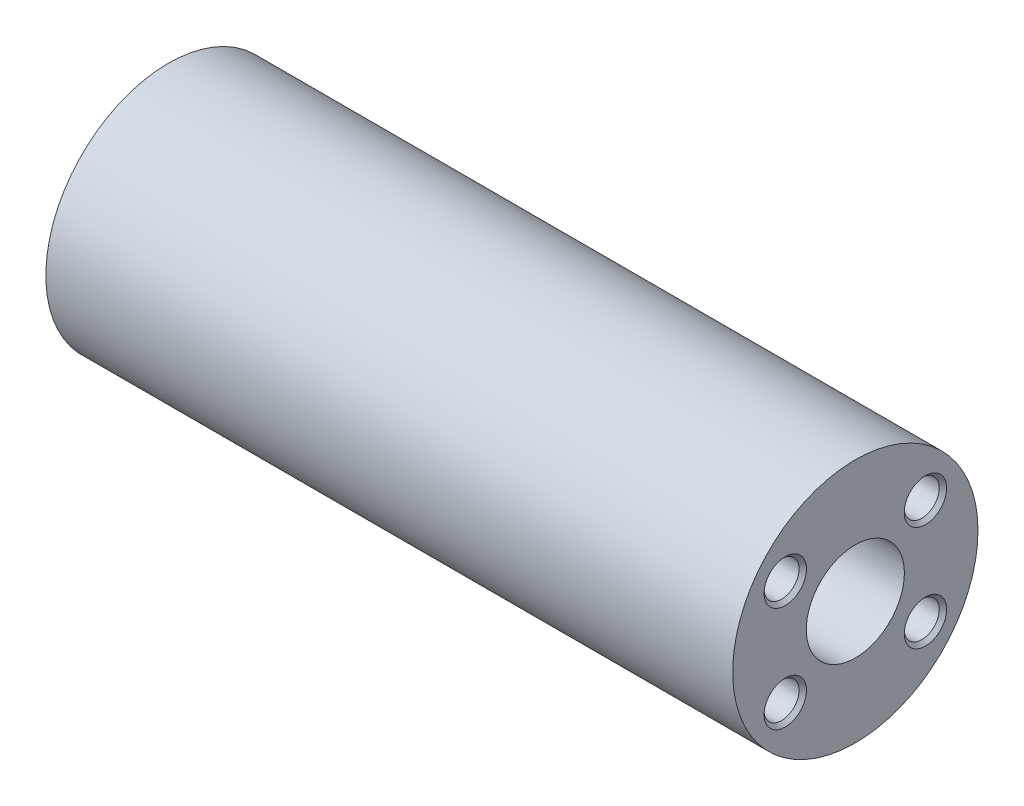
from build123d import *

# Parameters (mm, degrees)
SKETCH2_R           = 17.5
BOSS_EXTRUDE1_DEPTH = 49
CUT_EXTRUDE1_START  = -49
SKETCH3_R           = 7
CUT_EXTRUDE1_DEPTH  = 49


# Read off the part's stored shape, not the designer's step: M6 Tapped Hole1
with BuildPart() as part:
    # Sketch2 → Boss-Extrude1 (new, symmetric)
    with BuildSketch(Plane(origin=(0, 0, 0), x_dir=(0, 0, -1), z_dir=(1, 0, 0))):
        Circle(SKETCH2_R)
    extrude(amount=BOSS_EXTRUDE1_DEPTH, both=True)

    # Sketch3 → Cut-Extrude1 (cut)
    with BuildSketch(Plane(origin=(49, 0, 0), x_dir=(0, 0, -1), z_dir=(1, 0, 0)).offset(CUT_EXTRUDE1_START)):
        Circle(SKETCH3_R)
    extrude(amount=CUT_EXTRUDE1_DEPTH, mode=Mode.SUBTRACT)

    # M6 Tapped Hole1 outline → M6 Tapped Hole1 (revolve, cut)
    with BuildSketch(Plane(origin=(0, -7.5, -10), x_dir=(0, 1, 0), z_dir=(0, 0, -1))):
        Polygon((0, 49), (0, 31), (2.5, 32.502151548), (2.5, 48.475), (3.025, 49), align=None)
    m6_tapped_hole1 = revolve(axis=Axis((0, -7.5, -10), (1, 0, 0)), mode=Mode.SUBTRACT)

    # M6 Tapped Hole1 2 outline → M6 Tapped Hole1 2 (revolve, cut)
    with BuildSketch(Plane(origin=(0, 7.5, 10), x_dir=(0, 1, 0), z_dir=(0, 0, -1))):
        Polygon((0, 49), (0, 31), (2.5, 32.502151548), (2.5, 48.475), (3.025, 49), align=None)
    m6_tapped_hole1_2 = revolve(axis=Axis((0, 7.5, 10), (1, 0, 0)), mode=Mode.SUBTRACT)

    # M6 Tapped Hole1 3 outline → M6 Tapped Hole1 3 (revolve, cut)
    with BuildSketch(Plane(origin=(0, -7.5, 10), x_dir=(0, 1, 0), z_dir=(0, 0, -1))):
        Polygon((0, 49), (0, 31), (2.5, 32.502151548), (2.5, 48.475), (3.025, 49), align=None)
    m6_tapped_hole1_3 = revolve(axis=Axis((0, -7.5, 10), (1, 0, 0)), mode=Mode.SUBTRACT)

    # M6 Tapped Hole1 4 outline → M6 Tapped Hole1 4 (revolve, cut)
    with BuildSketch(Plane(origin=(0, 7.5, -10), x_dir=(0, 1, 0), z_dir=(0, 0, -1))):
        Polygon((0, 49), (0, 31), (2.5, 32.502151548), (2.5, 48.475), (3.025, 49), align=None)
    m6_tapped_hole1_4 = revolve(axis=Axis((0, 7.5, -10), (1, 0, 0)), mode=Mode.SUBTRACT)

    # Mirror1: M6 Tapped Hole1, M6 Tapped Hole1 2, M6 Tapped Hole1 3, M6 Tapped Hole1 4 across plane
    add(m6_tapped_hole1.mirror(Plane(origin=(0, 0, 0), x_dir=(0, 0, 1), z_dir=(1, 0, 0))), mode=Mode.SUBTRACT)
    add(m6_tapped_hole1_2.mirror(Plane(origin=(0, 0, 0), x_dir=(0, 0, 1), z_dir=(1, 0, 0))), mode=Mode.SUBTRACT)
    add(m6_tapped_hole1_3.mirror(Plane(origin=(0, 0, 0), x_dir=(0, 0, 1), z_dir=(1, 0, 0))), mode=Mode.SUBTRACT)
    add(m6_tapped_hole1_4.mirror(Plane(origin=(0, 0, 0), x_dir=(0, 0, 1), z_dir=(1, 0, 0))), mode=Mode.SUBTRACT)


solid = part.part
